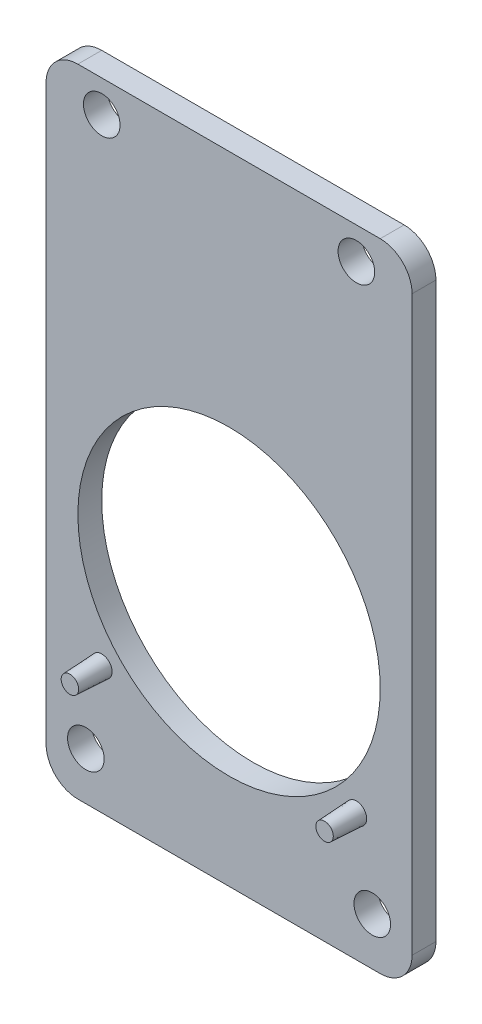
from build123d import *
from OCP.BRepFilletAPI import BRepFilletAPI_MakeChamfer

# Parameters (mm, degrees)
SKETCH_1_W          = 23
SKETCH_1_H          = 40
SKETCH_1_R          = 9.5
EXTRUDE_1_DEPTH     = 1.5
FILLET_1_R          = 2
SKETCH_3_R          = 1.15
CUT_EXTRUDE_1_DEPTH = 24.119256043
SKETCH_4_R          = 0.65
EXTRUDE_2_DEPTH     = 2
CHAMFER_1_SIZE      = 2
CHAMFER_1_SIZE_2    = 0.1


with BuildPart() as part:
    # 草图1 → 凸台-拉伸1 (new body)
    with BuildSketch(Plane.XY):
        Rectangle(SKETCH_1_W, SKETCH_1_H)
        with Locations((0, -4.5)):
            Circle(SKETCH_1_R, mode=Mode.SUBTRACT)
    extrude(amount=EXTRUDE_1_DEPTH)

    # 圆角1
    fillet_1_edges = [part.edges().sort_by_distance(p)[0] for p in [
        (11.5, -20, 0.75),
        (-11.5, -20, 0.75),
        (-11.5, 20, 0.75),
        (11.5, 20, 0.75),
    ]]
    fillet(fillet_1_edges, radius=FILLET_1_R)

    # 草图3 → 切除-拉伸1 (cut, through all)
    with BuildSketch(Plane.XY.offset(1.5)):
        with Locations((-8, 18)):
            Circle(SKETCH_3_R)
        with Locations((8, 18)):
            Circle(SKETCH_3_R)
        with Locations((-9, -17)):
            Circle(SKETCH_3_R)
        with Locations((9, -17)):
            Circle(SKETCH_3_R)
    extrude(amount=-CUT_EXTRUDE_1_DEPTH, mode=Mode.SUBTRACT)

    # 草图4 → 凸台-拉伸2 (add)
    with BuildSketch(Plane.XY.offset(1.5)):
        with Locations(Location((-8, -12, 0), (0, 0, 180))):
            Circle(SKETCH_4_R)
        with Locations(Location((8, -12, 0), (0, 0, 180))):
            Circle(SKETCH_4_R)
    extrude(amount=EXTRUDE_2_DEPTH)

    # 倒角1
    chamfer_1_edges_1 = [part.edges().sort_by_distance(p)[0] for p in [
        (-7.35, -12, 3.5),
    ]]
    chamfer_1_side_1 = [part.faces().sort_by_distance(p)[0] for p in [
        (-7.35, -12, 3.498),
    ]]
    chamfer_1_edges_2 = [part.edges().sort_by_distance(p)[0] for p in [
        (8.65, -12, 3.5),
    ]]
    chamfer_1_side_2 = [part.faces().sort_by_distance(p)[0] for p in [
        (8.65, -12, 3.498),
    ]]
    chamfer_1 = BRepFilletAPI_MakeChamfer(part.part.solid().wrapped)
    for e in chamfer_1_edges_1:
        chamfer_1.Add(CHAMFER_1_SIZE - 0.0001, CHAMFER_1_SIZE_2 - 0.0001, e.wrapped, chamfer_1_side_1[0].wrapped)
    for e in chamfer_1_edges_2:
        chamfer_1.Add(CHAMFER_1_SIZE - 0.0001, CHAMFER_1_SIZE_2 - 0.0001, e.wrapped, chamfer_1_side_2[0].wrapped)
    add(Compound.cast(chamfer_1.Shape()), mode=Mode.REPLACE)  # a hair under: the kernel refuses the full size


solid = part.part
